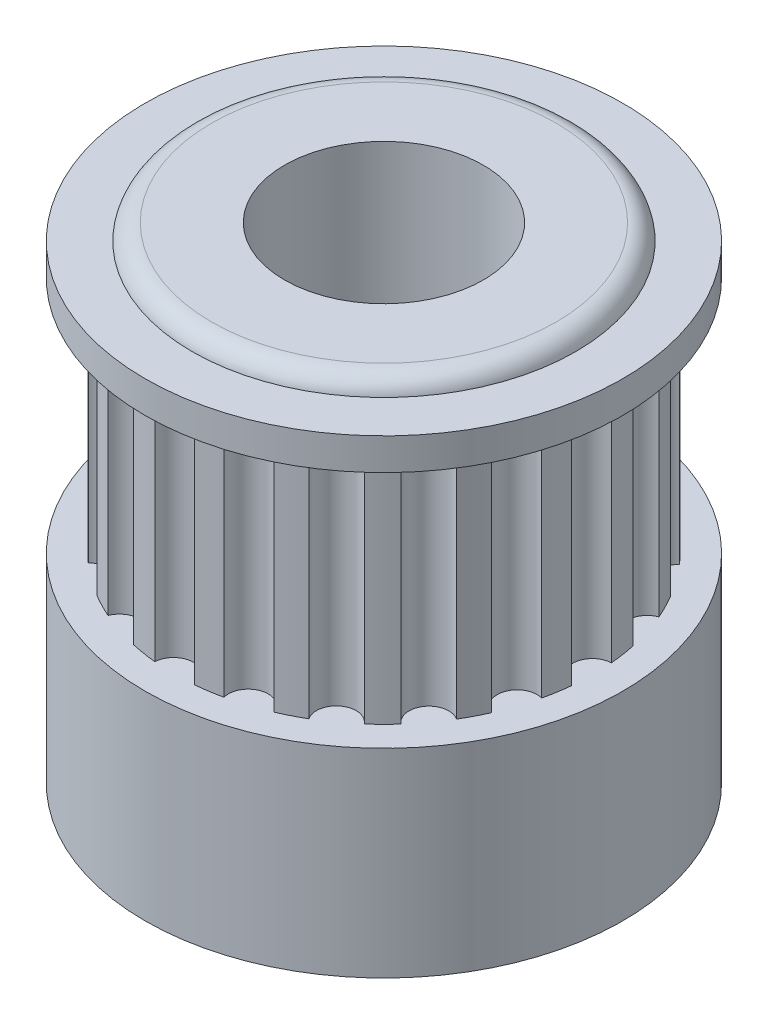
from build123d import *

# Parameters (mm, degrees)
SKETCH1_R           = 6
BOSS_EXTRUDE1_DEPTH = 5
SKETCH2_R           = 5.262480872
BOSS_EXTRUDE2_DEPTH = 6
SKETCH3_R           = 0.5
CUT_EXTRUDE1_DEPTH  = 6
SKETCH4_R           = 6
BOSS_EXTRUDE3_DEPTH = 0.8
SKETCH5_R           = 4.819461856
BOSS_EXTRUDE4_DEPTH = 0.4
FILLET3_R           = 0.5
SKETCH6_R           = 2.5
CUT_EXTRUDE2_DEPTH  = 15.860686391


with BuildPart() as part:
    # Sketch1 → Boss-Extrude1 (new body)
    with BuildSketch(Plane(origin=(0, 0, 0), x_dir=(1, 0, 0), z_dir=(0, 1, 0))):
        with Locations(Location((0, 0, 0), (0, 0, 270))):
            Circle(SKETCH1_R)
    extrude(amount=BOSS_EXTRUDE1_DEPTH)

    # Sketch2 → Boss-Extrude2 (add)
    with BuildSketch(Plane(origin=(0, 5, 0), x_dir=(1, 0, 0), z_dir=(0, 1, 0))):
        with Locations(Location((0, 0, 0), (0, 0, 270))):
            Circle(SKETCH2_R)
    extrude(amount=BOSS_EXTRUDE2_DEPTH)

    # Sketch3 → Cut-Extrude1 (cut)
    with BuildSketch(Plane(origin=(0, 11, 0), x_dir=(1, 0, 0), z_dir=(0, 1, 0))):
        with Locations((-1.603876434, 5.012113856)):
            Circle(SKETCH3_R)
        with Locations((0.023451225, 5.262428619)):
            Circle(SKETCH3_R)
        with Locations((1.648483316, 4.997620202)):
            Circle(SKETCH3_R)
        with Locations((3.112150373, 4.2436099)):
            Circle(SKETCH3_R)
        with Locations((4.271178469, 3.074205493)):
            Circle(SKETCH3_R)
        with Locations((5.012113856, 1.603876434)):
            Circle(SKETCH3_R)
        with Locations((5.262428619, -0.023451225)):
            Circle(SKETCH3_R)
        with Locations((4.997620202, -1.648483316)):
            Circle(SKETCH3_R)
        with Locations((4.2436099, -3.112150373)):
            Circle(SKETCH3_R)
        with Locations((3.074205493, -4.271178469)):
            Circle(SKETCH3_R)
        with Locations((1.603876434, -5.012113856)):
            Circle(SKETCH3_R)
        with Locations((-0.023451225, -5.262428619)):
            Circle(SKETCH3_R)
        with Locations((-1.648483316, -4.997620202)):
            Circle(SKETCH3_R)
        with Locations((-3.112150373, -4.2436099)):
            Circle(SKETCH3_R)
        with Locations((-4.271178469, -3.074205493)):
            Circle(SKETCH3_R)
        with Locations((-5.012113856, -1.603876434)):
            Circle(SKETCH3_R)
        with Locations((-5.262428619, 0.023451225)):
            Circle(SKETCH3_R)
        with Locations((-4.997620202, 1.648483316)):
            Circle(SKETCH3_R)
        with Locations((-4.2436099, 3.112150373)):
            Circle(SKETCH3_R)
        with Locations((-3.074205493, 4.271178469)):
            Circle(SKETCH3_R)
    extrude(amount=-CUT_EXTRUDE1_DEPTH, mode=Mode.SUBTRACT)

    # Sketch4 → Boss-Extrude3 (add)
    with BuildSketch(Plane(origin=(0, 11, 0), x_dir=(1, 0, 0), z_dir=(0, 1, 0))):
        with Locations(Location((0, 0, 0), (0, 0, 270))):
            Circle(SKETCH4_R)
    extrude(amount=BOSS_EXTRUDE3_DEPTH)

    # Sketch5 → Boss-Extrude4 (add)
    with BuildSketch(Plane(origin=(0, 11.8, 0), x_dir=(1, 0, 0), z_dir=(0, 1, 0))):
        with Locations(Location((0, 0, 0), (0, 0, 270))):
            Circle(SKETCH5_R)
    extrude(amount=BOSS_EXTRUDE4_DEPTH)

    # Fillet3
    # the kernel refuses this fillet: 0.5 mm, written as the material it takes off along each edge
    with BuildSketch(Plane(origin=(0, 12.2, 0), x_dir=(0, 0, 1), z_dir=(-1, 0, 0))) as fillet3_piece_1:
        with BuildLine():
            CenterArc((4.329563907, -0.5), FILLET3_R, 11.536959033, 78.463040967)
            Line((4.329563907, 0), (4.329563907, 0.01))
            Line((4.329563907, 0.01), (4.819461856, 0.01))
            Line((4.819461856, 0.01), (4.829461856, 0))
            ThreePointArc((4.829461856, 0), (4.829461856, -0.2), (4.829259815, -0.398))
            Line((4.829259815, -0.398), (4.819461856, -0.4))
        make_face()
    revolve(axis=Axis((0, 12.2, 0), (0, 1, 0)), mode=Mode.SUBTRACT)

    # Sketch6 → Cut-Extrude2 (cut, through all)
    with BuildSketch(Plane(origin=(0, 12.2, 0), x_dir=(1, 0, 0), z_dir=(0, 1, 0))):
        with Locations(Location((0, 0, 0), (0, 0, 270))):
            Circle(SKETCH6_R)
    extrude(amount=-CUT_EXTRUDE2_DEPTH, mode=Mode.SUBTRACT)


solid = part.part
